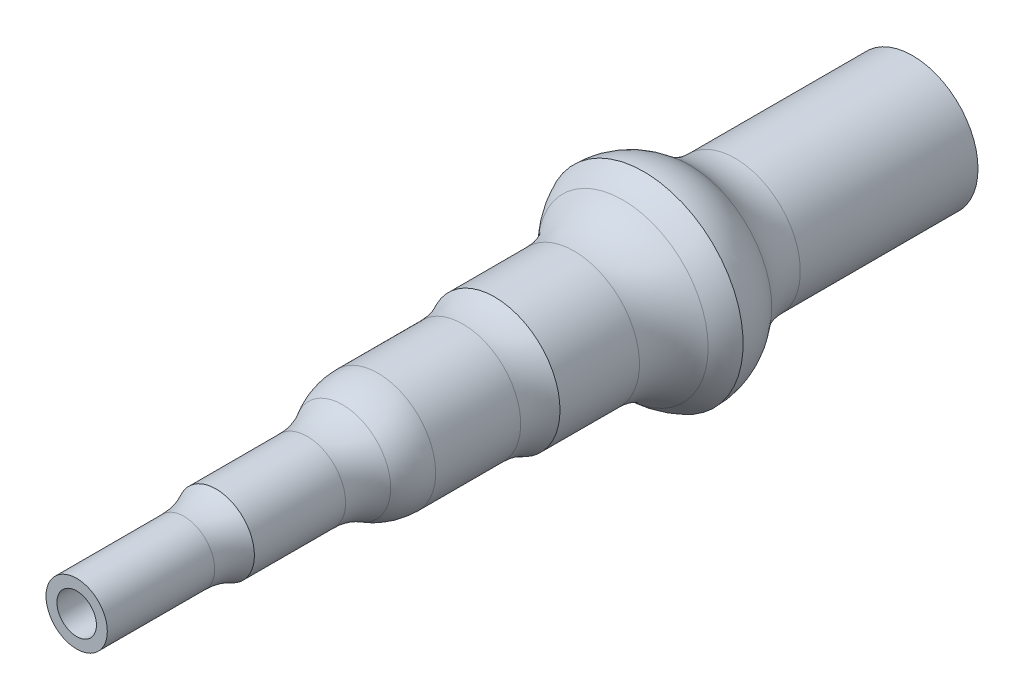
from build123d import *

# Parameters (mm, degrees)
SKETCH1_R           = 4.69
SKETCH1_R_2         = 2.2
BOSS_EXTRUDE3_DEPTH = 30
SKETCH3_R           = 4.14334423
SKETCH3_R_2         = 2.739824148
BOSS_EXTRUDE4_DEPTH = 10
SKETCH4_R           = 2.757198723
SKETCH4_R_2         = 1.67402832
BOSS_EXTRUDE5_DEPTH = 10
SKETCH5_R           = 2.2
SKETCH5_R_2         = 1.417715224
BOSS_EXTRUDE6_DEPTH = 10
FILLET13_R          = 5
FILLET15_R          = 5
FILLET16_R          = 5
FILLET17_R          = 5
FILLET19_R          = 5
FILLET20_R          = 5
FILLET21_R          = 5
BOSS_EXTRUDE7_START = -20
SKETCH6_R           = 7.130132291
BOSS_EXTRUDE7_DEPTH = 5
SKETCH7_R           = 3.768659845
CUT_EXTRUDE1_DEPTH  = 30
FILLET26_R          = 5
FILLET27_R          = 5
FILLET28_R          = 5
FILLET29_R          = 5
FILLET30_R          = 5


with BuildPart() as part:
    # Sketch1 → Boss-Extrude3 (new body)
    with BuildSketch(Plane.XY):
        Circle(SKETCH1_R)
        Circle(SKETCH1_R_2, mode=Mode.SUBTRACT)
    extrude(amount=BOSS_EXTRUDE3_DEPTH)

    # Sketch3 → Boss-Extrude4 (add)
    with BuildSketch(Plane.XY.offset(30)):
        Circle(SKETCH3_R)
        Circle(SKETCH3_R_2, mode=Mode.SUBTRACT)
    extrude(amount=BOSS_EXTRUDE4_DEPTH)

    # Sketch4 → Boss-Extrude5 (add)
    with BuildSketch(Plane.XY.offset(40)):
        Circle(SKETCH4_R)
        Circle(SKETCH4_R_2, mode=Mode.SUBTRACT)
    extrude(amount=BOSS_EXTRUDE5_DEPTH)

    # Sketch5 → Boss-Extrude6 (add)
    with BuildSketch(Plane.XY.offset(50)):
        Circle(SKETCH5_R)
        Circle(SKETCH5_R_2, mode=Mode.SUBTRACT)
    extrude(amount=BOSS_EXTRUDE6_DEPTH)

    # Fillet13
    # the kernel refuses this fillet: 5 mm, written as the material it takes off along each edge
    with BuildSketch(Plane(origin=(0, 0, 50), x_dir=(1, 0, 0), z_dir=(0, -1, 0))) as fillet13_piece_1:
        with BuildLine():
            CenterArc((6.417715224, 1.580327356), FILLET13_R, 180, 18.425147301)
            Line((1.417715224, 1.580327356), (1.317715224, 1.580327356))
            Line((1.317715224, 1.580327356), (1.317715224, 0))
            Line((1.317715224, 0), (1.417715224, -0.1))
            ThreePointArc((1.417715224, -0.1), (1.545871772, -0.1), (1.579154581, -0.031606547))
            Line((1.579154581, -0.031606547), (1.67402832, 0))
        make_face()
    revolve(axis=Axis((0, 0, 50), (0, 0, 1)), mode=Mode.SUBTRACT)

    # Fillet15
    fillet15_edges = [part.edges().sort_by_distance(p)[0] for p in [
        (-1.67402832, 0, 50),
    ]]
    fillet(fillet15_edges, radius=FILLET15_R)

    # Fillet16
    # the kernel refuses this fillet: 5 mm, written as the material it adds along each edge
    with BuildSketch(Plane(origin=(0, 0, 50), x_dir=(1, 0, 0), z_dir=(0, -1, 0))) as fillet16_piece_1:
        with BuildLine():
            CenterArc((7.2, 2.293799646), FILLET16_R, 180, 27.307116904)
            Line((2.757198723, 0), (2.668342698, -0.045875993))
            ThreePointArc((2.668342698, -0.045875993), (2.478599362, -0.1), (2.2, -0.1))
            Line((2.2, -0.1), (2.1, 0))
            Line((2.1, 0), (2.1, 2.293799646))
            Line((2.1, 2.293799646), (2.2, 2.293799646))
        make_face()
    revolve(axis=Axis((0, 0, 50), (0, 0, 1)))

    # Fillet17
    # the kernel refuses this fillet: 5 mm, written as the material it takes off along each edge
    with BuildSketch(Plane(origin=(0, 0, 40), x_dir=(1, 0, 0), z_dir=(0, -1, 0))) as fillet17_piece_1:
        with BuildLine():
            CenterArc((6.67402832, 3.085779891), FILLET17_R, 180, 38.108745083)
            Line((2.739824148, 0), (2.661140065, -0.061715598))
            ThreePointArc((2.661140065, -0.061715598), (2.206926234, -0.1), (1.67402832, -0.1))
            Line((1.67402832, -0.1), (1.57402832, 0))
            Line((1.57402832, 0), (1.57402832, 3.085779891))
            Line((1.57402832, 3.085779891), (1.67402832, 3.085779891))
        make_face()
    revolve(axis=Axis((0, 0, 40), (0, 0, 1)), mode=Mode.SUBTRACT)

    # Fillet18: read off the stored shape, not the designer's step
    # Fillet18 outline → Fillet18 (revolve)
    with BuildSketch(Plane.XZ):
        with BuildLine():
            Line((2.757198723, 40), (4.14334423, 40))
            ThreePointArc((4.14334423, 40), (3.116656057, 41.593889814), (2.757198723, 43.455438569))
            Line((2.757198723, 43.455438569), (2.757198723, 40))
        make_face()
    revolve(axis=Axis((0, 0, 0), (0, 0, 1)))

    # Fillet19
    fillet19_edges = [part.edges().sort_by_distance(p)[0] for p in [
        (-2.739824148, 0, 40),
    ]]
    fillet(fillet19_edges, radius=FILLET19_R)

    # Fillet20
    fillet20_edges = [part.edges().sort_by_distance(p)[0] for p in [
        (-4.14334423, 0, 40),
    ]]
    fillet(fillet20_edges, radius=FILLET20_R)

    # Fillet21
    # the kernel refuses this fillet: 5 mm, written as the material it adds along each edge
    with BuildSketch(Plane(origin=(0, 0, 30), x_dir=(1, 0, 0), z_dir=(0, -1, 0))) as fillet21_piece_1:
        with BuildLine():
            CenterArc((9.14334423, 2.27326311), FILLET21_R, 180, 27.042585546)
            Line((4.69, 0), (4.600933115, -0.045465262))
            ThreePointArc((4.600933115, -0.045465262), (4.416672115, -0.1), (4.14334423, -0.1))
            Line((4.14334423, -0.1), (4.04334423, 0))
            Line((4.04334423, 0), (4.04334423, 2.27326311))
            Line((4.04334423, 2.27326311), (4.14334423, 2.27326311))
        make_face()
    revolve(axis=Axis((0, 0, 30), (0, 0, 1)))

    # Sketch6 → Boss-Extrude7 (add)
    with BuildSketch(Plane(origin=(0, 0, 0), x_dir=(-1, 0, 0), z_dir=(0, 0, -1)).offset(BOSS_EXTRUDE7_START)):
        Circle(SKETCH6_R)
    extrude(amount=BOSS_EXTRUDE7_DEPTH)

    # Sketch7 → Cut-Extrude1 (cut)
    with BuildSketch(Plane(origin=(0, 0, 0), x_dir=(-1, 0, 0), z_dir=(0, 0, -1))):
        Circle(SKETCH7_R)
    extrude(amount=-CUT_EXTRUDE1_DEPTH, mode=Mode.SUBTRACT)

    # Fillet26
    # the kernel refuses this fillet: 5 mm, written as the material it adds along each edge
    with BuildSketch(Plane(origin=(0, 0, 20), x_dir=(1, 0, 0), z_dir=(0, 1, 0))) as fillet26_piece_1:
        with BuildLine():
            CenterArc((9.69, -4.29500609), FILLET26_R, 120.795376003, 59.204623997)
            Line((7.130132291, 0), (7.078934937, 0.085900122))
            ThreePointArc((7.078934937, 0.085900122), (5.910066146, 0.1), (4.69, 0.1))
            Line((4.69, 0.1), (4.59, 0))
            Line((4.59, 0), (4.59, -4.29500609))
            Line((4.59, -4.29500609), (4.69, -4.29500609))
        make_face()
    revolve(axis=Axis((0, 0, 20), (0, 0, -1)))

    # Fillet27
    # the kernel refuses this fillet: 5 mm, written as the material it takes off along each edge
    with BuildSketch(Plane(origin=(0, 0, 15), x_dir=(-1, 0, 0), z_dir=(0, -1, 0))) as fillet27_piece_1_section:
        with BuildLine():
            CenterArc((2.130132291, -4.29500609), FILLET27_R, 0, 59.204623997)
            Line((4.69, 0), (4.741197354, 0.085900122))
            ThreePointArc((4.741197354, 0.085900122), (5.910066146, 0.1), (7.130132291, 0.1))
            Line((7.130132291, 0.1), (7.230132291, 0))
            Line((7.230132291, 0), (7.230132291, -4.29500609))
            Line((7.230132291, -4.29500609), (7.130132291, -4.29500609))
        make_face()
    fillet27_piece_1 = revolve(axis=Axis((0, 0, 15), (0, 0, -1)), mode=Mode.PRIVATE)
    fillet27_piece_1 = fillet27_piece_1 - Plane(origin=(0, 0, 15), x_dir=(1, 0, 0), z_dir=(0, 0, -1)) * Cylinder(4.69, 29, mode=Mode.PRIVATE)
    add(fillet27_piece_1, mode=Mode.SUBTRACT)

    # Fillet28
    # the kernel refuses this fillet: 5 mm, written as the material it adds along each edge
    with BuildSketch(Plane(origin=(0, 0, 15), x_dir=(-1, 0, 0), z_dir=(0, -1, 0))) as fillet28_piece_1:
        with BuildLine():
            CenterArc((9.69, 2.250862854), FILLET28_R, 180, 40.888333518)
            Line((4.69, 2.250862854), (4.69, 0))
            ThreePointArc((4.69, 0), (5.340962178, -0.462177965), (5.910066146, -1.022071618))
        make_face()
    revolve(axis=Axis((0, 0, 15), (0, 0, -1)), revolution_arc=180)
    with BuildSketch(Plane(origin=(0, 0, 15), x_dir=(1, 0, 0), z_dir=(0, 1, 0))) as fillet28_piece_2:
        with BuildLine():
            CenterArc((9.69, 2.250862854), FILLET28_R, 180, 40.888333518)
            Line((4.69, 2.250862854), (4.69, 0))
            ThreePointArc((4.69, 0), (5.340962178, -0.462177965), (5.910066146, -1.022071618))
        make_face()
    revolve(axis=Axis((0, 0, 15), (0, 0, -1)), revolution_arc=180)
    # the kernel refuses this fillet: 5 mm, written as the material it takes off along each edge
    with BuildSketch(Plane(origin=(0, 0, 20), x_dir=(-1, 0, 0), z_dir=(0, -1, 0))) as fillet28_2_piece_1:
        with BuildLine():
            CenterArc((2.546742384, 2.703127277), FILLET28_R, 315.587970102, 20.857187789)
            Line((7.130132291, 0.70499391), (7.130132291, 0))
            ThreePointArc((7.130132291, 0), (6.598529109, -0.365272291), (6.118371192, -0.795939407))
        make_face()
    revolve(axis=Axis((0, 0, 20), (0, 0, -1)), revolution_arc=180, mode=Mode.SUBTRACT)
    with BuildSketch(Plane(origin=(0, 0, 20), x_dir=(1, 0, 0), z_dir=(0, 1, 0))) as fillet28_2_piece_2:
        with BuildLine():
            CenterArc((2.546742384, 2.703127277), FILLET28_R, 315.587970102, 20.857187789)
            Line((7.130132291, 0.70499391), (7.130132291, 0))
            ThreePointArc((7.130132291, 0), (6.598529109, -0.365272291), (6.118371192, -0.795939407))
        make_face()
    revolve(axis=Axis((0, 0, 20), (0, 0, -1)), revolution_arc=180, mode=Mode.SUBTRACT)

    # Fillet29
    # the kernel refuses this fillet: 5 mm, written as the material it takes off along each edge
    with BuildSketch(Plane(origin=(0, 0, 30), x_dir=(1, 0, 0), z_dir=(0, -1, 0))) as fillet29_piece_1:
        with BuildLine():
            CenterArc((7.739824148, 3.038067491), FILLET29_R, 180, 37.417142661)
            Line((2.739824148, 3.038067491), (2.639824148, 3.038067491))
            Line((2.639824148, 3.038067491), (2.639824148, 0))
            Line((2.639824148, 0), (2.739824148, -0.1))
            ThreePointArc((2.739824148, -0.1), (3.254241996, -0.1), (3.689236559, -0.06076135))
            Line((3.689236559, -0.06076135), (3.768659845, 0))
        make_face()
    revolve(axis=Axis((0, 0, 30), (0, 0, 1)), mode=Mode.SUBTRACT)

    # Fillet30
    fillet30_edges = [part.edges().sort_by_distance(p)[0] for p in [
        (0, -3.768659845, 30),
    ]]
    fillet(fillet30_edges, radius=FILLET30_R)


solid = part.part
